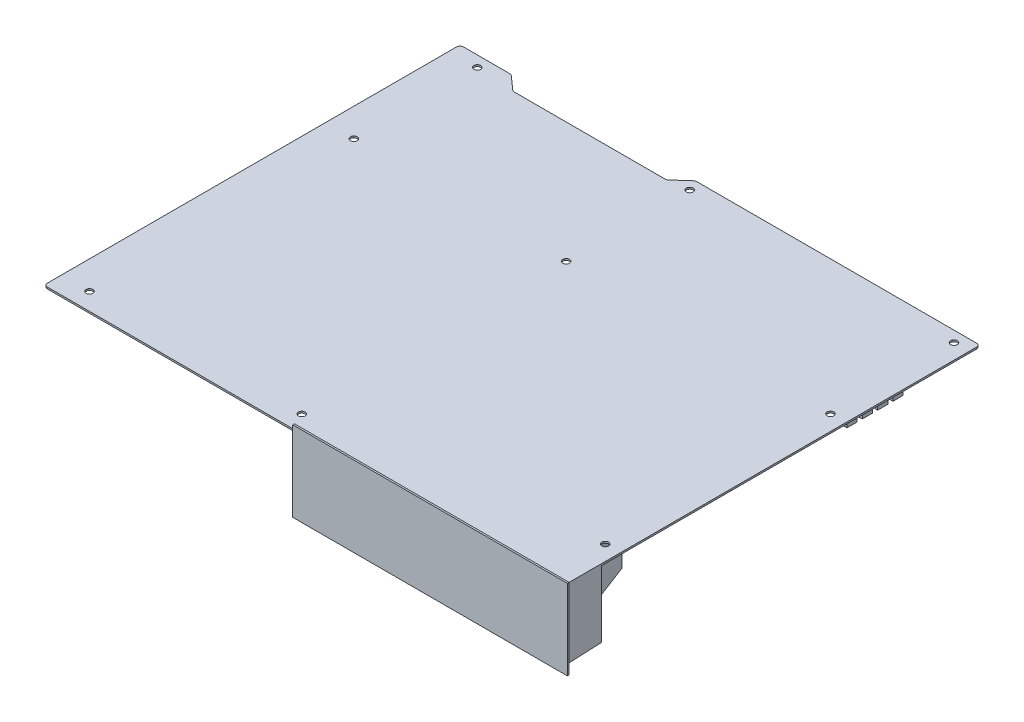
from build123d import *

# Parameters (mm, degrees)
SKETCH1_R           = 1.9812
BOSS_EXTRUDE1_DEPTH = 1
FILLET1_R           = 2
FILLET2_R           = 2
BOSS_EXTRUDE2_DEPTH = 40
SKETCH3_W           = 161
SKETCH3_H           = 47
BOSS_EXTRUDE3_DEPTH = 1
CUT_EXTRUDE1_DEPTH  = 225
SKETCH5_W           = 140
SKETCH5_H           = 6
BOSS_EXTRUDE4_DEPTH = 5
SKETCH6_W           = 6
SKETCH6_H           = 6
BOSS_EXTRUDE5_DEPTH = 12
SKETCH7_W           = 135
SKETCH7_H           = 1.5
CUT_EXTRUDE2_DEPTH  = 15
LPATTERN2_COUNT     = 4
LPATTERN2_PITCH     = 9
SKETCH8_W           = 6
SKETCH8_H           = 89
SKETCH8_W_2         = 2
SKETCH8_H_2         = 85
BOSS_EXTRUDE6_DEPTH = 12
SKETCH9_W           = 35
SKETCH9_H           = 30
BOSS_EXTRUDE7_DEPTH = 4


with BuildPart() as part:
    # Sketch1 → Boss-Extrude1 (new body)
    with BuildSketch(Plane(origin=(0, 0, 0), x_dir=(1, 0, 0), z_dir=(0, 1, 0))):
        Polygon((-152.4, 121.92), (-152.4, -121.92), (152.4, -121.92), (152.4, 121.92), (-14.4, 121.92), (-23.4, 113.92), (-113.4, 113.92), (-122.4, 121.92), align=None)
        with Locations((-11.43, -111.76)):
            Circle(SKETCH1_R, mode=Mode.SUBTRACT)
        with Locations((143.51, -88.9)):
            Circle(SKETCH1_R, mode=Mode.SUBTRACT)
        with Locations((-135.89, 43.18)):
            Circle(SKETCH1_R, mode=Mode.SUBTRACT)
        with Locations((-11.43, 115.57)):
            Circle(SKETCH1_R, mode=Mode.SUBTRACT)
        with Locations((-135.89, 115.57)):
            Circle(SKETCH1_R, mode=Mode.SUBTRACT)
        with Locations((143.51, 115.57)):
            Circle(SKETCH1_R, mode=Mode.SUBTRACT)
        with Locations((-135.89, -111.76)):
            Circle(SKETCH1_R, mode=Mode.SUBTRACT)
        with Locations((143.51, 43.18)):
            Circle(SKETCH1_R, mode=Mode.SUBTRACT)
        with Locations((-11.43, 43.18)):
            Circle(SKETCH1_R, mode=Mode.SUBTRACT)
    extrude(amount=BOSS_EXTRUDE1_DEPTH)

    # Fillet1
    fillet1_edges = [part.edges().sort_by_distance(p)[0] for p in [
        (-14.4, 0.5, -121.92),
        (-23.4, 0.5, -113.92),
        (-122.4, 0.5, -121.92),
        (-113.4, 0.5, -113.92),
    ]]
    fillet(fillet1_edges, radius=FILLET1_R)

    # Fillet2
    fillet2_edges = [part.edges().sort_by_distance(p)[0] for p in [
        (-152.4, 0.5, 121.92),
        (152.4, 0.5, -121.92),
        (-152.4, 0.5, -121.92),
    ]]
    fillet(fillet2_edges, radius=FILLET2_R)

    # Sketch2 → Boss-Extrude2 (add)
    with BuildSketch(Plane.XZ):
        Polygon((-2.6, 121.92), (152.4, 121.92), (152.4, 99.92), (134.319980014, 91.369393161), (122.529319933, 57.92), (24.529319933, 57.92), (-2.6, 99.92), align=None)
    extrude(amount=BOSS_EXTRUDE2_DEPTH)

    # Sketch3 → Boss-Extrude3 (add)
    with BuildSketch(Plane.XY.offset(121.92)):
        with Locations((74.9, -19.5)):
            Rectangle(SKETCH3_W, SKETCH3_H)
    extrude(amount=BOSS_EXTRUDE3_DEPTH)

    # Sketch4 → Cut-Extrude1 (cut, symmetric)
    with BuildSketch(Plane(origin=(0, 0, 0), x_dir=(0, 0, -1), z_dir=(1, 0, 0))):
        Polygon((-55.675354563, -37), (-121.92, -40), (-121.92, -43.768992378), (-55.675354563, -43.768992378), align=None)
    extrude(amount=CUT_EXTRUDE1_DEPTH, both=True, mode=Mode.SUBTRACT)

    # Sketch5 → Boss-Extrude4 (add)
    with BuildSketch(Plane.XZ):
        with Locations((67.4, -88.92)):
            Rectangle(SKETCH5_W, SKETCH5_H)
    boss_extrude4 = extrude(amount=BOSS_EXTRUDE4_DEPTH)

    # Sketch6 → Boss-Extrude5 (add)
    with BuildSketch(Plane.XZ.offset(5)):
        with Locations((134.4, -88.92)):
            Rectangle(SKETCH6_W, SKETCH6_H)
        with Locations((0.4, -88.92)):
            Rectangle(SKETCH6_W, SKETCH6_H)
    boss_extrude5 = extrude(amount=BOSS_EXTRUDE5_DEPTH)

    # Sketch7 → Cut-Extrude2 (cut)
    with BuildSketch(Plane.XZ.offset(17)):
        with Locations((67.4, -88.92)):
            Rectangle(SKETCH7_W, SKETCH7_H)
    cut_extrude2 = extrude(amount=-CUT_EXTRUDE2_DEPTH, mode=Mode.SUBTRACT)

    # LPattern2: Boss-Extrude4, Boss-Extrude5, Cut-Extrude2 ×4
    with Locations(*[(0, 0, i * LPATTERN2_PITCH) for i in range(1, LPATTERN2_COUNT)]):
        add(boss_extrude4)
        add(boss_extrude5)
        add(cut_extrude2, mode=Mode.SUBTRACT)

    # Sketch8 → Boss-Extrude6 (add)
    with BuildSketch(Plane.XZ):
        with Locations((-32.4, 34.42)):
            Rectangle(SKETCH8_W, SKETCH8_H)
        with Locations((-32.4, 34.42)):
            Rectangle(SKETCH8_W_2, SKETCH8_H_2, mode=Mode.SUBTRACT)
    extrude(amount=BOSS_EXTRUDE6_DEPTH)

    # Sketch9 → Boss-Extrude7 (add)
    with BuildSketch(Plane.XZ):
        with Locations((54.9, -1.92)):
            Rectangle(SKETCH9_W, SKETCH9_H)
    extrude(amount=BOSS_EXTRUDE7_DEPTH)


solid = part.part
